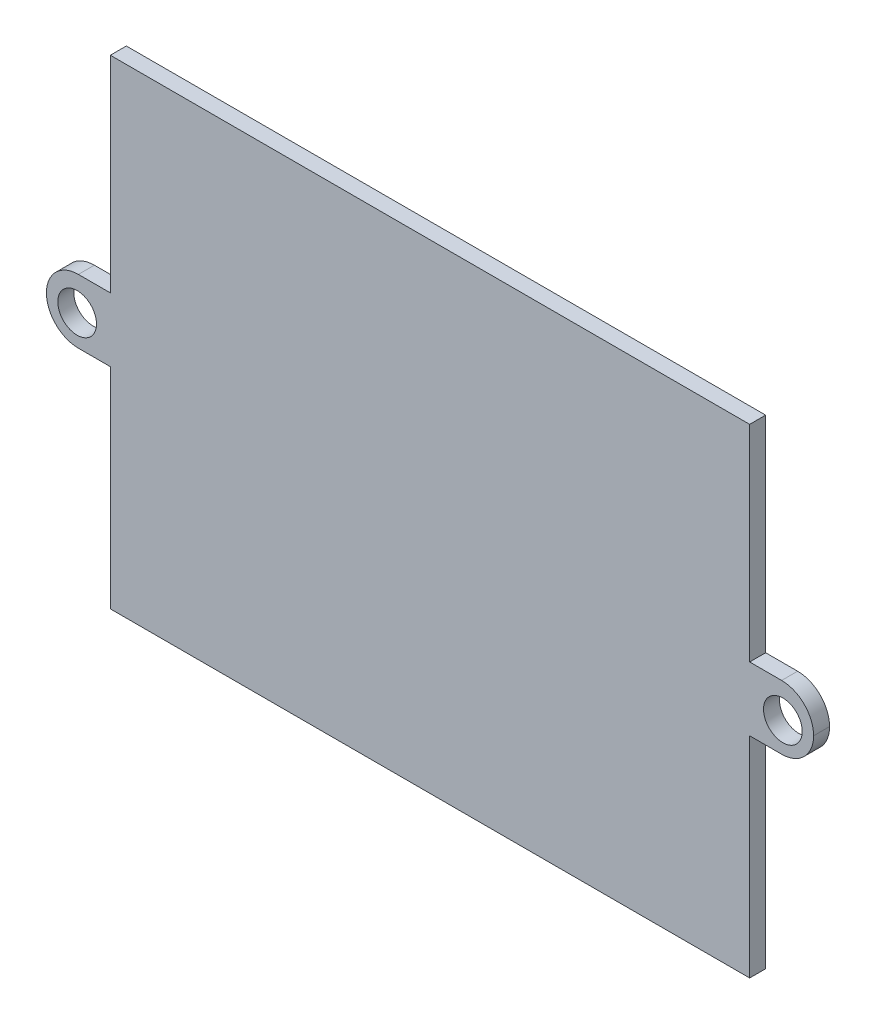
from build123d import *

# Parameters (mm, degrees)
SKETCH_1_W      = 200
SKETCH_1_H      = 150
EXTRUDE_1_DEPTH = 5
SKETCH_2_W      = 20
SKETCH_2_H      = 20
SKETCH_2_R      = 6.054352045
EXTRUDE_2_DEPTH = 5
FILLET_1_R      = 10


with BuildPart() as part:
    # 草图1 → 凸台-拉伸1 (new body)
    with BuildSketch(Plane.XY):
        Rectangle(SKETCH_1_W, SKETCH_1_H)
    extrude(amount=EXTRUDE_1_DEPTH)

    # 草图2 → 凸台-拉伸2 (add)
    # profile 1 of 2: a face of its own
    with BuildSketch(Plane.XY):
        with Locations((-110, 0.621152281)):
            Rectangle(SKETCH_2_W, SKETCH_2_H)
        with Locations((-110.38820767, 0)):
            Circle(SKETCH_2_R, mode=Mode.SUBTRACT)
    # profile 2 of 2: a face of its own
    with BuildSketch(Plane.XY):
        with Locations((110, 0.621152281)):
            Rectangle(SKETCH_2_W, SKETCH_2_H)
        with Locations(Location((110.38820767, 0, 0), (0, 0, 180))):
            Circle(SKETCH_2_R, mode=Mode.SUBTRACT)
    extrude(amount=EXTRUDE_2_DEPTH)

    # 圆角1
    fillet_1_edges = [part.edges().sort_by_distance(p)[0] for p in [
        (120, -9.378847719, 2.5),
        (120, 10.621152281, 2.5),
        (-120, -9.378847719, 2.5),
        (-120, 10.621152281, 2.5),
    ]]
    fillet(fillet_1_edges, radius=FILLET_1_R - 0.0001)  # a hair under: the kernel refuses the full size


solid = part.part
